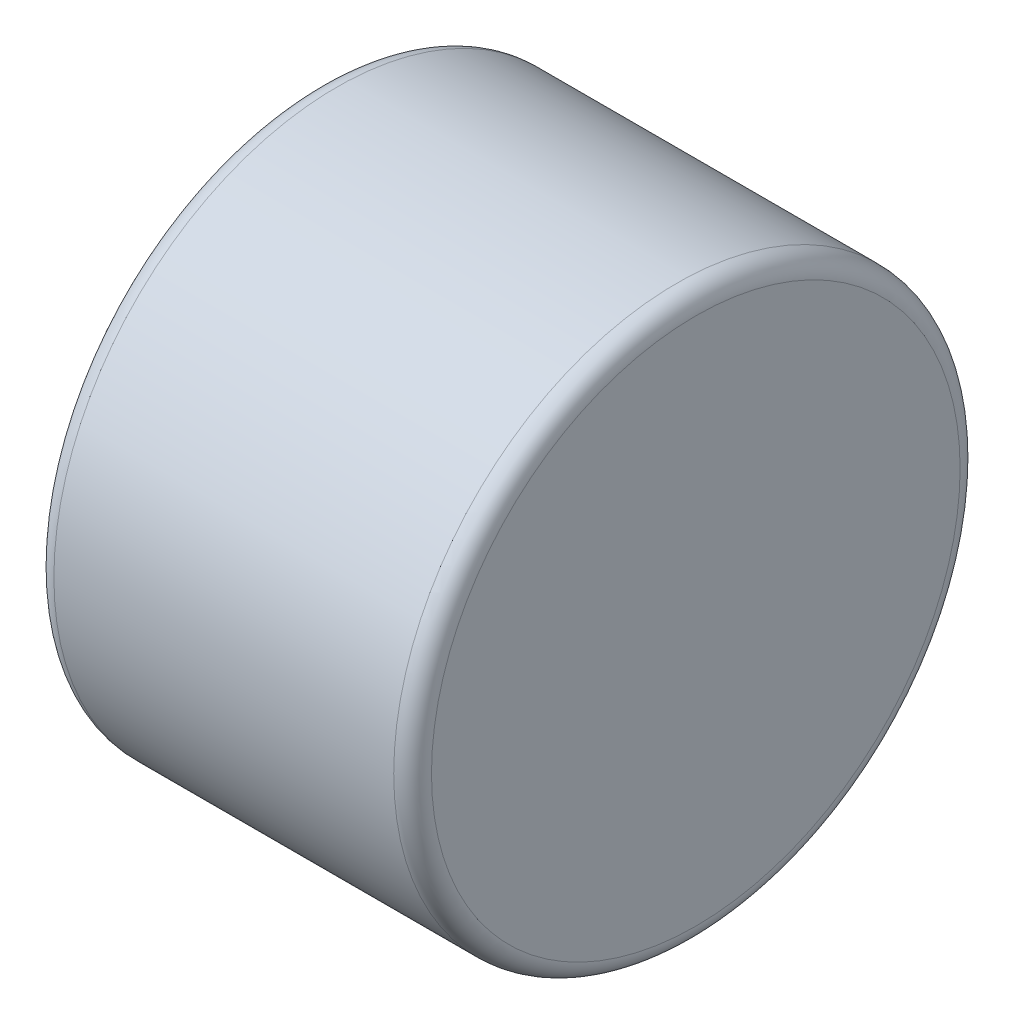
from build123d import *

# Parameters (mm, degrees)
SKETCH1_R           = 3
BOSS_EXTRUDE1_DEPTH = 2
FILLET1_R           = 0.2


with BuildPart() as part:
    # Sketch1 → Boss-Extrude1 (new, symmetric)
    with BuildSketch(Plane(origin=(0, 0, 0), x_dir=(0, 0, -1), z_dir=(1, 0, 0))):
        Circle(SKETCH1_R)
    extrude(amount=BOSS_EXTRUDE1_DEPTH, both=True)

    # Fillet1
    fillet1_edges = [part.edges().sort_by_distance(p)[0] for p in [
        (2, 0, 3),
        (-2, 0, 3),
    ]]
    fillet(fillet1_edges, radius=FILLET1_R)


solid = part.part
